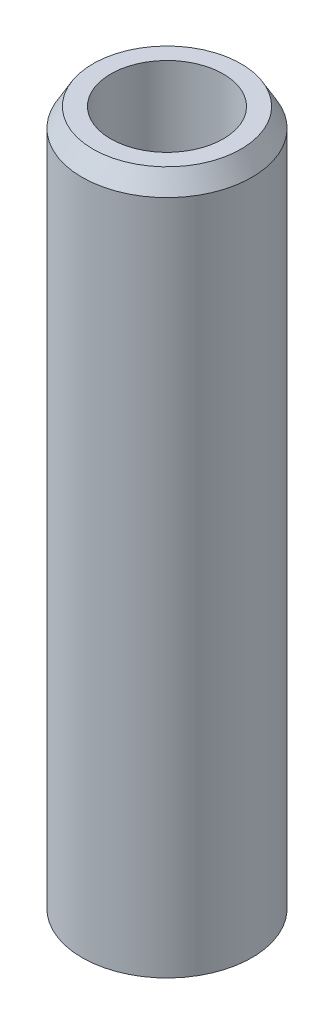
from build123d import *
from OCP.BRepFilletAPI import BRepFilletAPI_MakeChamfer

# Parameters (mm, degrees)
SKETCH1_R           = 22.5
BOSS_EXTRUDE1_DEPTH = 186.930161326
SKETCH2_R           = 14.909198987
CUT_EXTRUDE1_DEPTH  = 190.619052876
CHAMFER1_SIZE       = 5.018135149
CHAMFER1_SIZE2      = 2.897221679


with BuildPart() as part:
    # Sketch1 → Boss-Extrude1 (new body)
    with BuildSketch(Plane(origin=(0, 0, 0), x_dir=(1, 0, 0), z_dir=(0, 1, 0))):
        Circle(SKETCH1_R)
    extrude(amount=BOSS_EXTRUDE1_DEPTH)

    # Sketch2 → Cut-Extrude1 (cut, through all)
    with BuildSketch(Plane(origin=(0, 0, 0), x_dir=(1, 0, 0), z_dir=(0, 1, 0))):
        Circle(SKETCH2_R)
    extrude(amount=CUT_EXTRUDE1_DEPTH, mode=Mode.SUBTRACT)

    # Chamfer1: one chamfer whose edges measure the first distance from different faces: ONE call of the kernel's chamfer builder (chamfer() names one face for all edges)
    chamfer1_edges_1 = [part.edges().sort_by_distance(p)[0] for p in [
        (-22.5, 186.930161326, 0),
    ]]
    chamfer1_side_1 = [part.faces().sort_by_distance(p)[0] for p in [
        (-22.5, 93.465080663, 0),
    ]]
    chamfer1_edges_2 = [part.edges().sort_by_distance(p)[0] for p in [
        (-22.5, 0, 0),
    ]]
    chamfer1_side_2 = [part.faces().sort_by_distance(p)[0] for p in [
        (-21.863603897, 0, 0),
    ]]
    chamfer1 = BRepFilletAPI_MakeChamfer(part.part.solid().wrapped)
    for e in chamfer1_edges_1:
        chamfer1.Add(CHAMFER1_SIZE, CHAMFER1_SIZE2, e.wrapped, chamfer1_side_1[0].wrapped)  # the first distance lies on this face
    for e in chamfer1_edges_2:
        chamfer1.Add(CHAMFER1_SIZE, CHAMFER1_SIZE2, e.wrapped, chamfer1_side_2[0].wrapped)  # the first distance lies on this face
    add(Compound.cast(chamfer1.Shape()), mode=Mode.REPLACE)


solid = part.part
